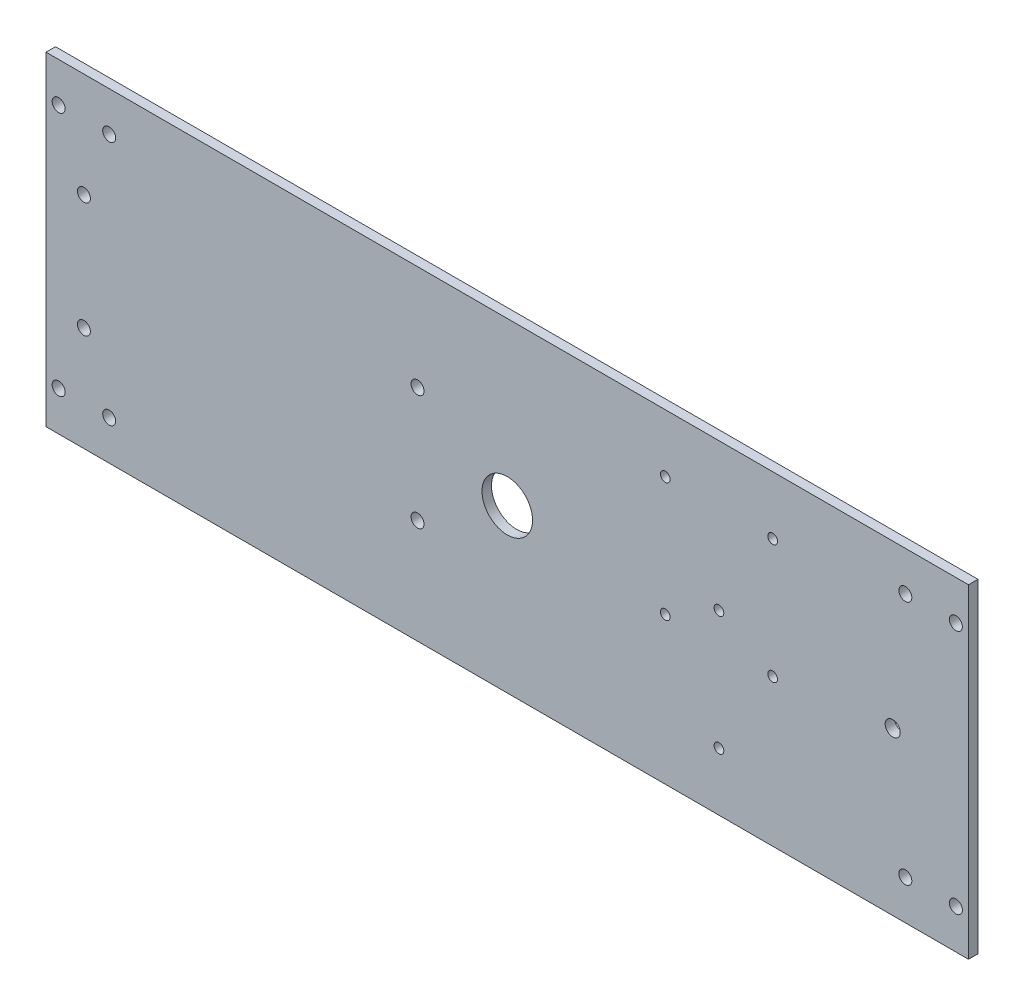
from build123d import *

# Parameters (mm, degrees)
SKETCH1_W                  = 231.775
SKETCH1_H                  = 81.4959
BOSS_EXTRUDE1_DEPTH        = 2.38125
F_4_CLEARANCE_HOLE2_D      = 3.2639
MIRROR3_COPY_1_D           = 3.2639
MIRROR3_COPY_2_D           = 3.2639
F_1_2_0_5_DIAMETER_HOLE1_D = 12.7
F_4_CLEARANCE_HOLE3_D      = 3.2639
F_2_CLEARANCE_HOLE1_D      = 2.4384
LPATTERN1_COUNT            = 2
LPATTERN1_PITCH            = 29.972
F_6_CLEARANCE_HOLE1_D      = 3.7973


with BuildPart() as part:
    # Sketch1 → Boss-Extrude1 (new body)
    with BuildSketch(Plane.XY):
        Rectangle(SKETCH1_W, SKETCH1_H)
    extrude(amount=BOSS_EXTRUDE1_DEPTH)

    # #4 Clearance Hole2 (through all)
    with Locations(Plane.XY.offset(2.38125)):
        with Locations((-112.7125, 30.82036), (-100.0125, 30.82036)):
            f_4_clearance_hole2 = Hole(F_4_CLEARANCE_HOLE2_D / 2)

    # Mirror2: #4 Clearance Hole2 across plane
    add(f_4_clearance_hole2.mirror(Plane(origin=(0, 0, 0), x_dir=(0, 0, 1), z_dir=(1, 0, 0))), mode=Mode.SUBTRACT)

    # Mirror3 copy 1 (through all)
    with Locations(Plane(origin=(0, 0, 2.38125), x_dir=(-1, 0, 0), z_dir=(0, 0, 1))):
        with Locations((-112.7125, 30.82036), (-100.0125, 30.82036)):
            Hole(MIRROR3_COPY_1_D / 2)

    # Mirror3 copy 2 (through all)
    with Locations(Plane.XY.offset(2.38125)):
        with Locations((-112.7125, -30.82036), (-100.0125, -30.82036)):
            Hole(MIRROR3_COPY_2_D / 2)

    # 1/2 (0.5) Diameter Hole1 (through all)
    with Locations(Plane.XY.offset(2.38125)):
        with Locations((0, 0)):
            Hole(F_1_2_0_5_DIAMETER_HOLE1_D / 2)

    # #4 Clearance Hole3 (through all)
    with Locations(Plane.XY.offset(2.38125)):
        with Locations((-106.3625, 14.478), (-22.5425, 14.478), (-22.5425, -14.478), (-106.3625, -14.478)):
            Hole(F_4_CLEARANCE_HOLE3_D / 2)

    # #2 Clearance Hole1 (through all)
    with Locations(Plane.XY.offset(2.38125)):
        with Locations((53.184353902, 3.81), (39.696953902, 26.162), (66.671753902, 26.162)):
            f_2_clearance_hole1 = Hole(F_2_CLEARANCE_HOLE1_D / 2)

    # LPattern1: #2 Clearance Hole1 ×2
    with Locations(*[(0, -i * LPATTERN1_PITCH, 0) for i in range(1, LPATTERN1_COUNT)]):
        add(f_2_clearance_hole1, mode=Mode.SUBTRACT)

    # #6 Clearance Hole1 (through all)
    with Locations(Plane.XY.offset(2.38125)):
        with Locations((96.8375, 0)):
            Hole(F_6_CLEARANCE_HOLE1_D / 2)


solid = part.part
